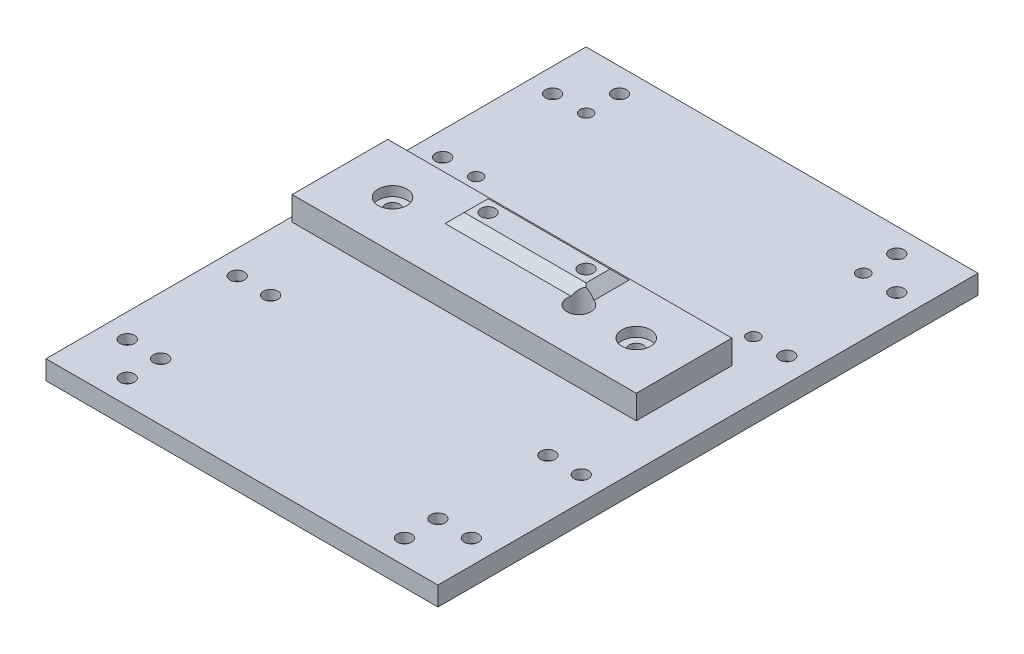
from build123d import *

# Parameters (mm, degrees)
SKETCH2_W           = 72
SKETCH2_H           = 20
BOSS_EXTRUDE1_DEPTH = 5
SKETCH1_R           = 6
SKETCH1_R_2         = 3
BOSS_EXTRUDE2_DEPTH = 4
SKETCH3_R           = 1.5
CUT_EXTRUDE1_DEPTH  = 39.431757701
SKETCH4_R           = 3
CUT_EXTRUDE2_DEPTH  = 2
SKETCH6_R           = 1.3
SKETCH6_R_2         = 1.5
BOSS_EXTRUDE4_DEPTH = 4
SKETCH8_R           = 2.5
CUT_EXTRUDE3_DEPTH  = 71.26556767
SKETCH10_R          = 1.5
CUT_EXTRUDE4_DEPTH  = 5
BOSS_EXTRUDE6_START = 2
SKETCH11_W          = 25.5
SKETCH11_H          = 5
SKETCH11_R          = 1.5
BOSS_EXTRUDE6_DEPTH = 2
SKETCH12_R          = 3
CUT_EXTRUDE5_DEPTH  = 2
CUT_EXTRUDE6_START  = -2
SKETCH14_R          = 3
CUT_EXTRUDE6_DEPTH  = 2


with BuildPart() as part:
    # Sketch2 → Boss-Extrude1 (new body)
    with BuildSketch(Plane(origin=(0, 0, 0), x_dir=(1, 0, 0), z_dir=(0, 1, 0))):
        Rectangle(SKETCH2_W, SKETCH2_H)
    extrude(amount=BOSS_EXTRUDE1_DEPTH)

    # Sketch1 → Boss-Extrude2 (add)
    with BuildSketch(Plane(origin=(0, 0, 0), x_dir=(1, 0, 0), z_dir=(0, 1, 0))):
        with Locations(Location((-25, 0, 0), (0, 0, 270))):
            Circle(SKETCH1_R)
        with Locations(Location((26, 0, 0), (0, 0, 270))):
            Circle(SKETCH1_R_2)
    extrude(amount=-BOSS_EXTRUDE2_DEPTH)

    # Sketch3 → Cut-Extrude1 (cut, through all)
    with BuildSketch(Plane.XZ.offset(4)):
        with Locations(Location((-25, 0, 0), (0, 0, 270))):
            Circle(SKETCH3_R)
        with Locations(Location((26, 0, 0), (0, 0, 270))):
            Circle(SKETCH3_R)
    extrude(amount=-CUT_EXTRUDE1_DEPTH, mode=Mode.SUBTRACT)

    # Sketch4 → Cut-Extrude2 (cut)
    with BuildSketch(Plane(origin=(0, 5, 0), x_dir=(1, 0, 0), z_dir=(0, 1, 0))):
        with Locations(Location((-25, 0, 0), (0, 0, 270))):
            Circle(SKETCH4_R)
        with Locations(Location((26, 0, 0), (0, 0, 270))):
            Circle(SKETCH4_R)
    extrude(amount=-CUT_EXTRUDE2_DEPTH, mode=Mode.SUBTRACT)

    # Sketch8 → Cut-Extrude3 (cut, through all)
    with BuildSketch(Plane.XZ):
        with Locations(Location((14, 0, 0), (0, 0, 270))):
            Circle(SKETCH8_R)
    extrude(amount=-CUT_EXTRUDE3_DEPTH, mode=Mode.SUBTRACT)

    # Sketch10 → Cut-Extrude4 (cut)
    with BuildSketch(Plane(origin=(0, 5, 0), x_dir=(1, 0, 0), z_dir=(0, 1, 0))):
        with Locations(Location((-10.25, 5.25, 0), (0, 0, 270))):
            Circle(SKETCH10_R)
        with Locations(Location((10.25, 5.25, 0), (0, 0, 270))):
            Circle(SKETCH10_R)
    extrude(amount=-CUT_EXTRUDE4_DEPTH, mode=Mode.SUBTRACT)

    # Sketch11 → Boss-Extrude6 (add)
    with BuildSketch(Plane(origin=(0, 5, 0), x_dir=(1, 0, 0), z_dir=(0, 1, 0)).offset(BOSS_EXTRUDE6_START)):
        with Locations((0, 5.25)):
            Rectangle(SKETCH11_W, SKETCH11_H)
        with Locations(Location((-10.25, 5.25, 0), (0, 0, 270))):
            Circle(SKETCH11_R, mode=Mode.SUBTRACT)
        with Locations(Location((10.25, 5.25, 0), (0, 0, 270))):
            Circle(SKETCH11_R, mode=Mode.SUBTRACT)
    extrude(amount=-BOSS_EXTRUDE6_DEPTH)

    # Chamfer2
    # the kernel refuses this chamfer: 2 mm, written as the material it adds along each edge
    with BuildSketch(Plane(origin=(-12.75, 5, -2.75), x_dir=(0, -0.027495876610586487, 0.9996219169112968), z_dir=(1, 0, 0))) as chamfer2_piece_1_section:
        with BuildLine():
            Line((2.05734639, 0), (-0.11309431, -2.054235587))
            Line((-0.11309431, -2.054235587), (-0.153079186, -2.053135752))
            ThreePointArc((-0.153079186, -2.053135752), (-0.068258454, -1.026795659), (-0.039984877, 0.001099835))
            Line((-0.039984877, 0.001099835), (0.001099835, 0.039984877))
            ThreePointArc((0.001099835, 0.039984877), (1.028995329, 0.011711299), (2.058446225, 0.039984877))
            Line((2.058446225, 0.039984877), (2.05734639, 0))
        make_face()
    chamfer2_piece_1 = extrude(amount=25.5, mode=Mode.PRIVATE)
    chamfer2_piece_1 = chamfer2_piece_1 - Plane(origin=(14, 5.660762518, 0), x_dir=(0, 0, -1), z_dir=(0, -1, 0)) * Cylinder(2.5, 60, mode=Mode.PRIVATE)
    chamfer2_piece_1 = split(chamfer2_piece_1, bisect_by=Plane(origin=(-0.134065272, 7, -2.095887334), z_dir=(0, -1, 0)), keep=Keep.TOP, mode=Mode.PRIVATE)
    add(chamfer2_piece_1)
    with BuildSketch(Plane(origin=(12.75, 5, -2.75), x_dir=(0.9996219169112968, -0.027495876610586487, 0), z_dir=(0, 0, -1))) as chamfer2_piece_2_section:
        with BuildLine():
            Line((2.05734639, 0), (-0.11309431, -2.054235587))
            Line((-0.11309431, -2.054235587), (-0.153079186, -2.053135752))
            ThreePointArc((-0.153079186, -2.053135752), (-0.068258454, -1.026795659), (-0.039984877, 0.001099835))
            Line((-0.039984877, 0.001099835), (0.001099835, 0.039984877))
            ThreePointArc((0.001099835, 0.039984877), (1.028995329, 0.011711299), (2.058446225, 0.039984877))
            Line((2.058446225, 0.039984877), (2.05734639, 0))
        make_face()
    chamfer2_piece_2 = extrude(amount=5, mode=Mode.PRIVATE)
    chamfer2_piece_2 = split(chamfer2_piece_2, bisect_by=Plane(origin=(13.410808309, 7, -5.25), z_dir=(0, -1, 0)), keep=Keep.TOP, mode=Mode.PRIVATE)
    add(chamfer2_piece_2)
    with BuildSketch(Plane(origin=(12.75, 5, -7.75), x_dir=(0, -0.027495876610586487, -0.9996219169112968), z_dir=(-1, 0, 0))) as chamfer2_piece_3_section:
        with BuildLine():
            Line((2.05734639, 0), (-0.11309431, -2.054235587))
            Line((-0.11309431, -2.054235587), (-0.153079186, -2.053135752))
            ThreePointArc((-0.153079186, -2.053135752), (-0.068258454, -1.026795659), (-0.039984877, 0.001099835))
            Line((-0.039984877, 0.001099835), (0.001099835, 0.039984877))
            ThreePointArc((0.001099835, 0.039984877), (1.028995329, 0.011711299), (2.058446225, 0.039984877))
            Line((2.058446225, 0.039984877), (2.05734639, 0))
        make_face()
    chamfer2_piece_3 = extrude(amount=25.5, mode=Mode.PRIVATE)
    chamfer2_piece_3 = split(chamfer2_piece_3, bisect_by=Plane(origin=(0, 7, -8.410808309), z_dir=(0, -1, 0)), keep=Keep.TOP, mode=Mode.PRIVATE)
    add(chamfer2_piece_3)
    with BuildSketch(Plane(origin=(-12.75, 5, -7.75), x_dir=(-0.9996219169112968, -0.027495876610586487, 0), z_dir=(0, 0, 1))) as chamfer2_piece_4_section:
        with BuildLine():
            Line((2.05734639, 0), (-0.11309431, -2.054235587))
            Line((-0.11309431, -2.054235587), (-0.153079186, -2.053135752))
            ThreePointArc((-0.153079186, -2.053135752), (-0.068258454, -1.026795659), (-0.039984877, 0.001099835))
            Line((-0.039984877, 0.001099835), (0.001099835, 0.039984877))
            ThreePointArc((0.001099835, 0.039984877), (1.028995329, 0.011711299), (2.058446225, 0.039984877))
            Line((2.058446225, 0.039984877), (2.05734639, 0))
        make_face()
    chamfer2_piece_4 = extrude(amount=5, mode=Mode.PRIVATE)
    chamfer2_piece_4 = split(chamfer2_piece_4, bisect_by=Plane(origin=(-13.410808309, 7, -5.25), z_dir=(0, -1, 0)), keep=Keep.TOP, mode=Mode.PRIVATE)
    add(chamfer2_piece_4)
    with BuildSketch(Plane(origin=(-12.75, 5, -7.75), x_dir=(-0.9996219169112968, -0.027495876610586487, 0), z_dir=(0, 0, 1))) as chamfer2_piece_5a_section:
        with BuildLine():
            Line((2.05734639, 0), (-0.11309431, -2.054235587))
            Line((-0.11309431, -2.054235587), (-0.153079186, -2.053135752))
            ThreePointArc((-0.153079186, -2.053135752), (-0.068258454, -1.026795659), (-0.039984877, 0.001099835))
            Line((-0.039984877, 0.001099835), (0.001099835, 0.039984877))
            ThreePointArc((0.001099835, 0.039984877), (1.028995329, 0.011711299), (2.058446225, 0.039984877))
            Line((2.058446225, 0.039984877), (2.05734639, 0))
        make_face()
    chamfer2_piece_5a = extrude(amount=7.05734639, mode=Mode.PRIVATE)
    chamfer2_piece_5a = split(chamfer2_piece_5a, bisect_by=Plane(origin=(-13.410808309, 7, -1.721326805), z_dir=(0, -1, 0)), keep=Keep.TOP, mode=Mode.PRIVATE)
    chamfer2_piece_5a = split(chamfer2_piece_5a, bisect_by=Plane(origin=(-13.410808309, 5.657268668, -2.75), z_dir=(0, 0, 1)), keep=Keep.TOP, mode=Mode.PRIVATE)
    with BuildSketch(Plane(origin=(-14.80734639, 5, -2.75), x_dir=(0, -0.027495876610586487, 0.9996219169112968), z_dir=(1, 0, 0))) as chamfer2_piece_5b_section:
        with BuildLine():
            Line((2.05734639, 0), (-0.11309431, -2.054235587))
            Line((-0.11309431, -2.054235587), (-0.153079186, -2.053135752))
            ThreePointArc((-0.153079186, -2.053135752), (-0.068258454, -1.026795659), (-0.039984877, 0.001099835))
            Line((-0.039984877, 0.001099835), (0.001099835, 0.039984877))
            ThreePointArc((0.001099835, 0.039984877), (1.028995329, 0.011711299), (2.058446225, 0.039984877))
            Line((2.058446225, 0.039984877), (2.05734639, 0))
        make_face()
    chamfer2_piece_5b = extrude(amount=27.55734639, mode=Mode.PRIVATE)
    chamfer2_piece_5b = split(chamfer2_piece_5b, bisect_by=Plane(origin=(-13.778673195, 7, -2.089191691), z_dir=(0, -1, 0)), keep=Keep.TOP, mode=Mode.PRIVATE)
    chamfer2_piece_5b = split(chamfer2_piece_5b, bisect_by=Plane(origin=(-12.75, 5.657268668, -2.089191691), z_dir=(-1, 0, 0)), keep=Keep.TOP, mode=Mode.PRIVATE)
    chamfer2_piece_5 = chamfer2_piece_5a & chamfer2_piece_5b
    add(chamfer2_piece_5)
    with BuildSketch(Plane(origin=(-12.75, 5, -2.75), x_dir=(0, -0.027495876610586487, 0.9996219169112968), z_dir=(1, 0, 0))) as chamfer2_piece_6a_section:
        with BuildLine():
            Line((2.05734639, 0), (-0.11309431, -2.054235587))
            Line((-0.11309431, -2.054235587), (-0.153079186, -2.053135752))
            ThreePointArc((-0.153079186, -2.053135752), (-0.068258454, -1.026795659), (-0.039984877, 0.001099835))
            Line((-0.039984877, 0.001099835), (0.001099835, 0.039984877))
            ThreePointArc((0.001099835, 0.039984877), (1.028995329, 0.011711299), (2.058446225, 0.039984877))
            Line((2.058446225, 0.039984877), (2.05734639, 0))
        make_face()
    chamfer2_piece_6a = extrude(amount=27.55734639, mode=Mode.PRIVATE)
    chamfer2_piece_6a = chamfer2_piece_6a - Plane(origin=(14, 5.933617383, 0), x_dir=(0, 0, -1), z_dir=(0, -1, 0)) * Cylinder(2.5, 64, mode=Mode.PRIVATE)
    chamfer2_piece_6a = split(chamfer2_piece_6a, bisect_by=Plane(origin=(13.702845422, 7, -2.606312664), z_dir=(0, -1, 0)), keep=Keep.TOP, mode=Mode.PRIVATE)
    chamfer2_piece_6a = split(chamfer2_piece_6a, bisect_by=Plane(origin=(12.75, 5.933617383, -2.606312664), z_dir=(1, 0, 0)), keep=Keep.TOP, mode=Mode.PRIVATE)
    with BuildSketch(Plane(origin=(12.75, 5, -0.69265361), x_dir=(0.9996219169112968, -0.027495876610586487, 0), z_dir=(0, 0, -1))) as chamfer2_piece_6b_section:
        with BuildLine():
            Line((2.05734639, 0), (-0.11309431, -2.054235587))
            Line((-0.11309431, -2.054235587), (-0.153079186, -2.053135752))
            ThreePointArc((-0.153079186, -2.053135752), (-0.068258454, -1.026795659), (-0.039984877, 0.001099835))
            Line((-0.039984877, 0.001099835), (0.001099835, 0.039984877))
            ThreePointArc((0.001099835, 0.039984877), (1.028995329, 0.011711299), (2.058446225, 0.039984877))
            Line((2.058446225, 0.039984877), (2.05734639, 0))
        make_face()
    chamfer2_piece_6b = extrude(amount=7.05734639, mode=Mode.PRIVATE)
    chamfer2_piece_6b = chamfer2_piece_6b - Plane(origin=(14, 5.726450415, 0), x_dir=(0, 0, -1), z_dir=(0, -1, 0)) * Cylinder(2.5, 23, mode=Mode.PRIVATE)
    chamfer2_piece_6b = split(chamfer2_piece_6b, bisect_by=Plane(origin=(13.28343187, 7, -2.545767831), z_dir=(0, -1, 0)), keep=Keep.TOP, mode=Mode.PRIVATE)
    chamfer2_piece_6b = split(chamfer2_piece_6b, bisect_by=Plane(origin=(13.28343187, 5.726450415, -2.75), z_dir=(0, 0, 1)), keep=Keep.TOP, mode=Mode.PRIVATE)
    chamfer2_piece_6 = chamfer2_piece_6a & chamfer2_piece_6b
    add(chamfer2_piece_6)
    with BuildSketch(Plane(origin=(12.75, 5, -2.75), x_dir=(0.9996219169112968, -0.027495876610586487, 0), z_dir=(0, 0, -1))) as chamfer2_piece_7a_section:
        with BuildLine():
            Line((2.05734639, 0), (-0.11309431, -2.054235587))
            Line((-0.11309431, -2.054235587), (-0.153079186, -2.053135752))
            ThreePointArc((-0.153079186, -2.053135752), (-0.068258454, -1.026795659), (-0.039984877, 0.001099835))
            Line((-0.039984877, 0.001099835), (0.001099835, 0.039984877))
            ThreePointArc((0.001099835, 0.039984877), (1.028995329, 0.011711299), (2.058446225, 0.039984877))
            Line((2.058446225, 0.039984877), (2.05734639, 0))
        make_face()
    chamfer2_piece_7a = extrude(amount=7.05734639, mode=Mode.PRIVATE)
    chamfer2_piece_7a = split(chamfer2_piece_7a, bisect_by=Plane(origin=(13.410808309, 5.657268668, -7.75), z_dir=(0, 0, -1)), keep=Keep.TOP, mode=Mode.PRIVATE)
    chamfer2_piece_7a = split(chamfer2_piece_7a, bisect_by=Plane(origin=(13.410808309, 7, -8.778673195), z_dir=(0, -1, 0)), keep=Keep.TOP, mode=Mode.PRIVATE)
    with BuildSketch(Plane(origin=(14.80734639, 5, -7.75), x_dir=(0, -0.027495876610586487, -0.9996219169112968), z_dir=(-1, 0, 0))) as chamfer2_piece_7b_section:
        with BuildLine():
            Line((2.05734639, 0), (-0.11309431, -2.054235587))
            Line((-0.11309431, -2.054235587), (-0.153079186, -2.053135752))
            ThreePointArc((-0.153079186, -2.053135752), (-0.068258454, -1.026795659), (-0.039984877, 0.001099835))
            Line((-0.039984877, 0.001099835), (0.001099835, 0.039984877))
            ThreePointArc((0.001099835, 0.039984877), (1.028995329, 0.011711299), (2.058446225, 0.039984877))
            Line((2.058446225, 0.039984877), (2.05734639, 0))
        make_face()
    chamfer2_piece_7b = extrude(amount=27.55734639, mode=Mode.PRIVATE)
    chamfer2_piece_7b = split(chamfer2_piece_7b, bisect_by=Plane(origin=(12.75, 5.657268668, -8.410808309), z_dir=(1, 0, 0)), keep=Keep.TOP, mode=Mode.PRIVATE)
    chamfer2_piece_7b = split(chamfer2_piece_7b, bisect_by=Plane(origin=(13.778673195, 7, -8.410808309), z_dir=(0, -1, 0)), keep=Keep.TOP, mode=Mode.PRIVATE)
    chamfer2_piece_7 = chamfer2_piece_7a & chamfer2_piece_7b
    add(chamfer2_piece_7)
    with BuildSketch(Plane(origin=(-12.75, 5, -9.80734639), x_dir=(-0.9996219169112968, -0.027495876610586487, 0), z_dir=(0, 0, 1))) as chamfer2_piece_8a_section:
        with BuildLine():
            Line((2.05734639, 0), (-0.11309431, -2.054235587))
            Line((-0.11309431, -2.054235587), (-0.153079186, -2.053135752))
            ThreePointArc((-0.153079186, -2.053135752), (-0.068258454, -1.026795659), (-0.039984877, 0.001099835))
            Line((-0.039984877, 0.001099835), (0.001099835, 0.039984877))
            ThreePointArc((0.001099835, 0.039984877), (1.028995329, 0.011711299), (2.058446225, 0.039984877))
            Line((2.058446225, 0.039984877), (2.05734639, 0))
        make_face()
    chamfer2_piece_8a = extrude(amount=7.05734639, mode=Mode.PRIVATE)
    chamfer2_piece_8a = split(chamfer2_piece_8a, bisect_by=Plane(origin=(-13.410808309, 5.657268668, -7.75), z_dir=(0, 0, -1)), keep=Keep.TOP, mode=Mode.PRIVATE)
    chamfer2_piece_8a = split(chamfer2_piece_8a, bisect_by=Plane(origin=(-13.410808309, 7, -8.778673195), z_dir=(0, -1, 0)), keep=Keep.TOP, mode=Mode.PRIVATE)
    with BuildSketch(Plane(origin=(12.75, 5, -7.75), x_dir=(0, -0.027495876610586487, -0.9996219169112968), z_dir=(-1, 0, 0))) as chamfer2_piece_8b_section:
        with BuildLine():
            Line((2.05734639, 0), (-0.11309431, -2.054235587))
            Line((-0.11309431, -2.054235587), (-0.153079186, -2.053135752))
            ThreePointArc((-0.153079186, -2.053135752), (-0.068258454, -1.026795659), (-0.039984877, 0.001099835))
            Line((-0.039984877, 0.001099835), (0.001099835, 0.039984877))
            ThreePointArc((0.001099835, 0.039984877), (1.028995329, 0.011711299), (2.058446225, 0.039984877))
            Line((2.058446225, 0.039984877), (2.05734639, 0))
        make_face()
    chamfer2_piece_8b = extrude(amount=27.55734639, mode=Mode.PRIVATE)
    chamfer2_piece_8b = split(chamfer2_piece_8b, bisect_by=Plane(origin=(-12.75, 5.657268668, -8.410808309), z_dir=(-1, 0, 0)), keep=Keep.TOP, mode=Mode.PRIVATE)
    chamfer2_piece_8b = split(chamfer2_piece_8b, bisect_by=Plane(origin=(-13.778673195, 7, -8.410808309), z_dir=(0, -1, 0)), keep=Keep.TOP, mode=Mode.PRIVATE)
    chamfer2_piece_8 = chamfer2_piece_8a & chamfer2_piece_8b
    add(chamfer2_piece_8)

    # Sketch12 → Cut-Extrude5 (cut)
    with BuildSketch(Plane.XZ):
        with Locations(Location((-10.25, -5.25, 0), (0, 0, 270))):
            Circle(SKETCH12_R)
        with Locations(Location((10.25, -5.25, 0), (0, 0, 270))):
            Circle(SKETCH12_R)
    extrude(amount=-CUT_EXTRUDE5_DEPTH, mode=Mode.SUBTRACT)


with BuildPart() as body_2:
    # Sketch6 → Boss-Extrude4 (new body)
    with BuildSketch(Plane.XZ.offset(4)):
        Polygon((-36, -56.5), (36, -56.5), (41, -56.5), (41, 56.5), (36, 56.5), (-36, 56.5), (-41, 56.5), (-41, -56.5), align=None)
        with Locations(Location((-29, -21.5, 0), (0, 0, 270))):
            Circle(SKETCH6_R, mode=Mode.SUBTRACT)
        with Locations(Location((-29, -44.5, 0), (0, 0, 270))):
            Circle(SKETCH6_R, mode=Mode.SUBTRACT)
        with Locations(Location((29, -44.5, 0), (0, 0, 90))):
            Circle(SKETCH6_R, mode=Mode.SUBTRACT)
        with Locations(Location((29, -21.5, 0), (0, 0, 90))):
            Circle(SKETCH6_R, mode=Mode.SUBTRACT)
        with Locations(Location((-25, 0, 0), (0, 0, 270))):
            Circle(SKETCH6_R_2, mode=Mode.SUBTRACT)
        with Locations(Location((26, 0, 0), (0, 0, 270))):
            Circle(SKETCH6_R_2, mode=Mode.SUBTRACT)
        with Locations(Location((-29, 44.5, 0), (0, 0, 270))):
            Circle(SKETCH6_R_2, mode=Mode.SUBTRACT)
        with Locations(Location((-29, 21.5, 0), (0, 0, 270))):
            Circle(SKETCH6_R_2, mode=Mode.SUBTRACT)
        with Locations(Location((29, 21.5, 0), (0, 0, 270))):
            Circle(SKETCH6_R_2, mode=Mode.SUBTRACT)
        with Locations(Location((29, 44.5, 0), (0, 0, 270))):
            Circle(SKETCH6_R_2, mode=Mode.SUBTRACT)
        with Locations(Location((-29, 51.5, 0), (0, 0, 270))):
            Circle(SKETCH6_R_2, mode=Mode.SUBTRACT)
        with Locations(Location((29, 51.5, 0), (0, 0, 90))):
            Circle(SKETCH6_R_2, mode=Mode.SUBTRACT)
        with Locations(Location((29, -51.5, 0), (0, 0, 270))):
            Circle(SKETCH6_R_2, mode=Mode.SUBTRACT)
        with Locations(Location((-29, -51.5, 0), (0, 0, 90))):
            Circle(SKETCH6_R_2, mode=Mode.SUBTRACT)
        with Locations(Location((-36, 44.5, 0), (0, 0, 270))):
            Circle(SKETCH6_R_2, mode=Mode.SUBTRACT)
        with Locations(Location((-36, 21.5, 0), (0, 0, 270))):
            Circle(SKETCH6_R_2, mode=Mode.SUBTRACT)
        with Locations(Location((36, 44.5, 0), (0, 0, 90))):
            Circle(SKETCH6_R_2, mode=Mode.SUBTRACT)
        with Locations(Location((36, 21.5, 0), (0, 0, 90))):
            Circle(SKETCH6_R_2, mode=Mode.SUBTRACT)
        with Locations(Location((36, -44.5, 0), (0, 0, 270))):
            Circle(SKETCH6_R_2, mode=Mode.SUBTRACT)
        with Locations(Location((36, -21.5, 0), (0, 0, 270))):
            Circle(SKETCH6_R_2, mode=Mode.SUBTRACT)
        with Locations(Location((-36, -21.5, 0), (0, 0, 90))):
            Circle(SKETCH6_R_2, mode=Mode.SUBTRACT)
        with Locations(Location((-36, -44.5, 0), (0, 0, 90))):
            Circle(SKETCH6_R_2, mode=Mode.SUBTRACT)
    extrude(amount=BOSS_EXTRUDE4_DEPTH)

    # Sketch14 → Cut-Extrude6 (cut)
    with BuildSketch(Plane.XZ.offset(8).offset(CUT_EXTRUDE6_START)):
        with Locations(Location((-25, 0, 0), (0, 0, 270))):
            Circle(SKETCH14_R)
        with Locations(Location((26, 0, 0), (0, 0, 270))):
            Circle(SKETCH14_R)
        with BuildLine():
            Line((-36, 47.5), (-32, 47.5))
            Line((-32, 47.5), (-32, 51.5))
            ThreePointArc((-32, 51.5), (-29, 54.5), (-26, 51.5))
            Line((-26, 51.5), (-26, 44.5))
            ThreePointArc((-26, 44.5), (-26.878679656, 42.378679656), (-29, 41.5))
            Line((-29, 41.5), (-36, 41.5))
            ThreePointArc((-36, 41.5), (-39, 44.5), (-36, 47.5))
        make_face()
        with BuildLine():
            Line((-36, 24.5), (-29, 24.5))
            ThreePointArc((-29, 24.5), (-26, 21.5), (-29, 18.5))
            Line((-29, 18.5), (-36, 18.5))
            ThreePointArc((-36, 18.5), (-39, 21.5), (-36, 24.5))
        make_face()
        with BuildLine():
            Line((36, 18.5), (29, 18.5))
            ThreePointArc((29, 18.5), (26, 21.5), (29, 24.5))
            Line((29, 24.5), (36, 24.5))
            ThreePointArc((36, 24.5), (39, 21.5), (36, 18.5))
        make_face()
        with BuildLine():
            Line((26, 44.5), (26, 51.5))
            ThreePointArc((26, 51.5), (29, 54.5), (32, 51.5))
            Line((32, 51.5), (32, 47.5))
            Line((32, 47.5), (36, 47.5))
            ThreePointArc((36, 47.5), (39, 44.5), (36, 41.5))
            Line((36, 41.5), (29, 41.5))
            ThreePointArc((29, 41.5), (26.878679656, 42.378679656), (26, 44.5))
        make_face()
        with BuildLine():
            Line((36, -47.5), (32, -47.5))
            Line((32, -47.5), (32, -51.5))
            ThreePointArc((32, -51.5), (29, -54.5), (26, -51.5))
            Line((26, -51.5), (26, -44.5))
            ThreePointArc((26, -44.5), (26.878679656, -42.378679656), (29, -41.5))
            Line((29, -41.5), (36, -41.5))
            ThreePointArc((36, -41.5), (39, -44.5), (36, -47.5))
        make_face()
        with BuildLine():
            Line((36, -24.5), (29, -24.5))
            ThreePointArc((29, -24.5), (26, -21.5), (29, -18.5))
            Line((29, -18.5), (36, -18.5))
            ThreePointArc((36, -18.5), (39, -21.5), (36, -24.5))
        make_face()
        with BuildLine():
            Line((-36, -18.5), (-29, -18.5))
            ThreePointArc((-29, -18.5), (-26, -21.5), (-29, -24.5))
            Line((-29, -24.5), (-36, -24.5))
            ThreePointArc((-36, -24.5), (-39, -21.5), (-36, -18.5))
        make_face()
        with BuildLine():
            Line((-26, -44.5), (-26, -51.5))
            ThreePointArc((-26, -51.5), (-29, -54.5), (-32, -51.5))
            Line((-32, -51.5), (-32, -47.5))
            Line((-32, -47.5), (-36, -47.5))
            ThreePointArc((-36, -47.5), (-39, -44.5), (-36, -41.5))
            Line((-36, -41.5), (-29, -41.5))
            ThreePointArc((-29, -41.5), (-26.878679656, -42.378679656), (-26, -44.5))
        make_face()
    extrude(amount=CUT_EXTRUDE6_DEPTH, mode=Mode.SUBTRACT)


solid = Compound([part.part, body_2.part])
